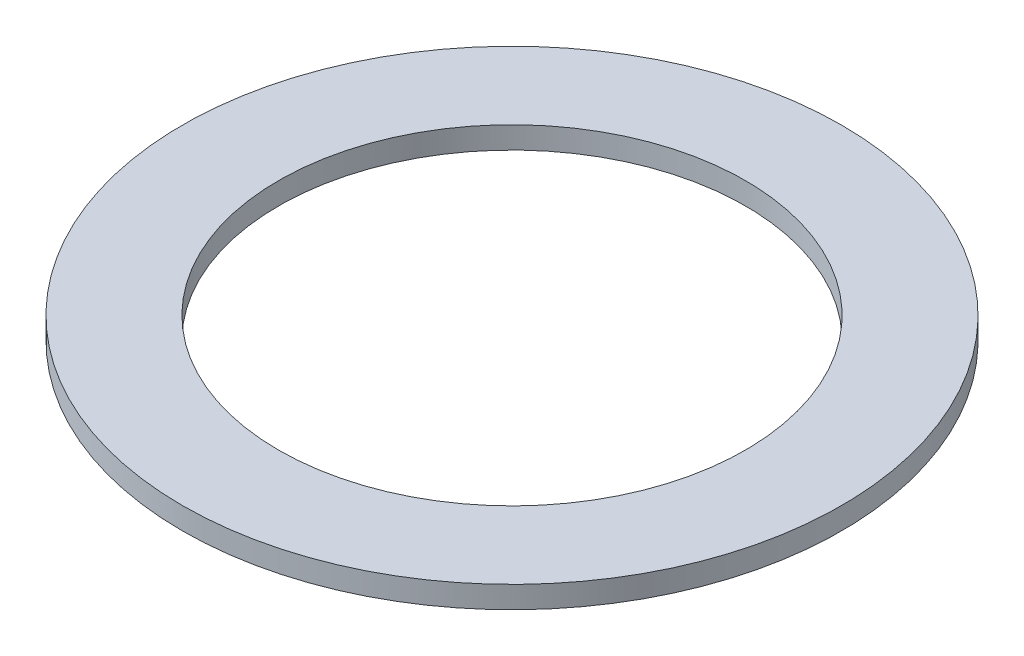
from build123d import *

# Parameters (mm, degrees)
SKETCH1_R           = 60
BOSS_EXTRUDE1_DEPTH = 4
SKETCH2_R           = 42.5
CUT_EXTRUDE1_DEPTH  = 85.947042326


with BuildPart() as part:
    # Sketch1 → Boss-Extrude1 (new body)
    with BuildSketch(Plane(origin=(0, 0, 0), x_dir=(1, 0, 0), z_dir=(0, 1, 0))):
        Circle(SKETCH1_R)
    extrude(amount=BOSS_EXTRUDE1_DEPTH)

    # Sketch2 → Cut-Extrude1 (cut, through all)
    with BuildSketch(Plane(origin=(0, 0, 0), x_dir=(1, 0, 0), z_dir=(0, 1, 0))):
        Circle(SKETCH2_R)
    extrude(amount=CUT_EXTRUDE1_DEPTH, mode=Mode.SUBTRACT)


solid = part.part
